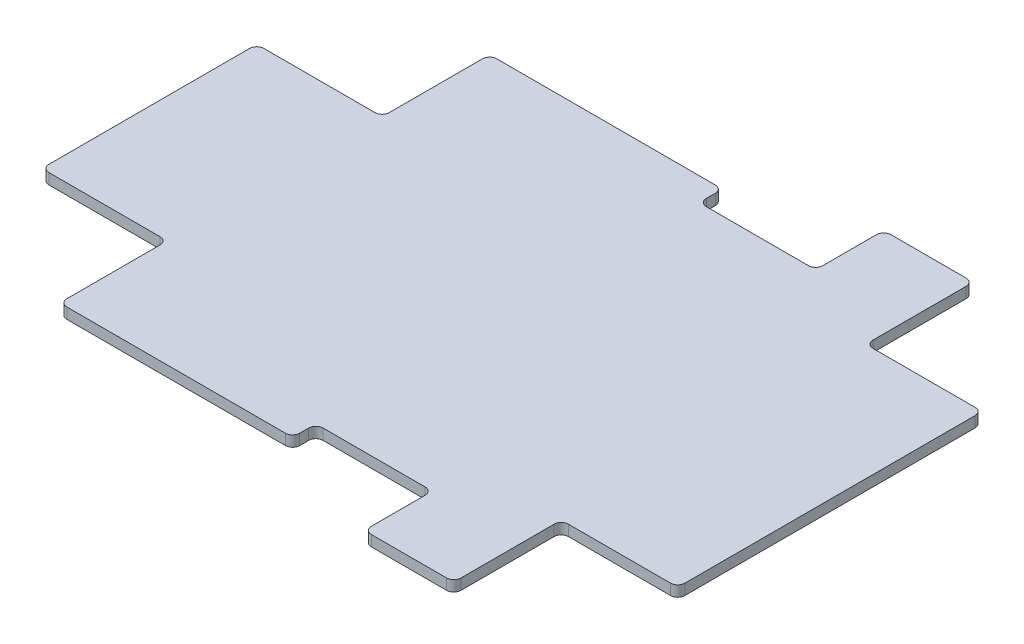
from build123d import *

# Parameters (mm, degrees)
SALIENTE_EXTRUIR1_DEPTH = 6
REDONDEO1_R             = 4


with BuildPart() as part:
    # Croquis1 → Saliente-Extruir1 (new body)
    with BuildSketch(Plane(origin=(0, 0, 0), x_dir=(1, 0, 0), z_dir=(0, 1, 0))):
        Polygon((0, 0), (-380, 0), (-380, 60), (-310, 60), (-310, 120), (-180, 120), (-180, 107), (-115, 107), (-115, 145), (-65, 145), (-65, 85), (0, 85), align=None)
    saliente_extruir1 = extrude(amount=SALIENTE_EXTRUIR1_DEPTH)

    # Simetría1: Saliente-Extruir1 across plane
    add(saliente_extruir1.mirror(Plane(origin=(0, 6, 0), x_dir=(1, 0, 0), z_dir=(0, 0, -1))))

    # Redondeo1
    redondeo1_edges = [part.edges().sort_by_distance(p)[0] for p in [
        (-380, 3, -60),
        (-310, 3, -60),
        (-310, 3, -120),
        (-180, 3, -120),
        (-180, 3, -107),
        (-115, 3, -107),
        (-115, 3, -145),
        (-65, 3, -85),
        (-65, 3, -145),
        (0, 3, -85),
        (0, 3, 85),
        (-65, 3, 85),
        (-65, 3, 145),
        (-115, 3, 145),
        (-115, 3, 107),
        (-180, 3, 107),
        (-180, 3, 120),
        (-310, 3, 120),
        (-310, 3, 60),
        (-380, 3, 60),
    ]]
    fillet(redondeo1_edges, radius=REDONDEO1_R)


solid = part.part
